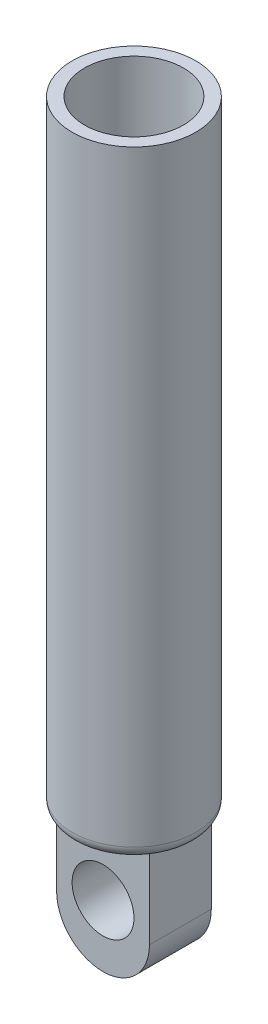
from build123d import *

# Parameters (mm, degrees)
SKETCH1_R                = 10
BOSS_EXTRUDE1_DEPTH      = 100
SHELL1_T                 = -2
FILLET1_R                = 2
BOSS_EXTRUDE2_DEPTH      = 20
BOSS_EXTRUDE2_DEPTH_BACK = 1
SKETCH2_W                = 15
SKETCH2_H                = 10
SKETCH3_R                = 5
CUT_EXTRUDE1_DEPTH       = 20
FILLET2_R                = 7.5


with BuildPart() as part:
    # Sketch1 → Boss-Extrude1 (new body)
    with BuildSketch(Plane(origin=(0, 0, 0), x_dir=(1, 0, 0), z_dir=(0, 1, 0))):
        with Locations(Location((0, 0, 0), (0, 0, 270))):
            Circle(SKETCH1_R)
    extrude(amount=BOSS_EXTRUDE1_DEPTH)

    # Shell1
    shell1_openings = [part.faces().sort_by_distance(p)[0] for p in [
        (0, 100, 0),
    ]]
    offset(amount=SHELL1_T, openings=shell1_openings, kind=Kind.INTERSECTION)

    # Fillet1
    fillet1_edges = [part.edges().sort_by_distance(p)[0] for p in [
        (0, 0, -10),
    ]]
    fillet(fillet1_edges, radius=FILLET1_R)

    # Sketch2 → Boss-Extrude2 (add, two sides: drawn at the far end of the back side and taken through both)
    with BuildSketch(Plane.XZ.offset(-BOSS_EXTRUDE2_DEPTH_BACK)):
        Rectangle(SKETCH2_W, SKETCH2_H)
    extrude(amount=BOSS_EXTRUDE2_DEPTH + BOSS_EXTRUDE2_DEPTH_BACK)

    # Sketch3 → Cut-Extrude1 (cut)
    with BuildSketch(Plane.XY.offset(5)):
        with Locations((0, -10)):
            Circle(SKETCH3_R)
    extrude(amount=-CUT_EXTRUDE1_DEPTH, mode=Mode.SUBTRACT)

    # Fillet2
    fillet2_edges = [part.edges().sort_by_distance(p)[0] for p in [
        (7.5, -20, 0),
        (-7.5, -20, 0),
    ]]
    fillet(fillet2_edges, radius=FILLET2_R - 0.0001)  # a hair under: the kernel refuses the full size


solid = part.part
